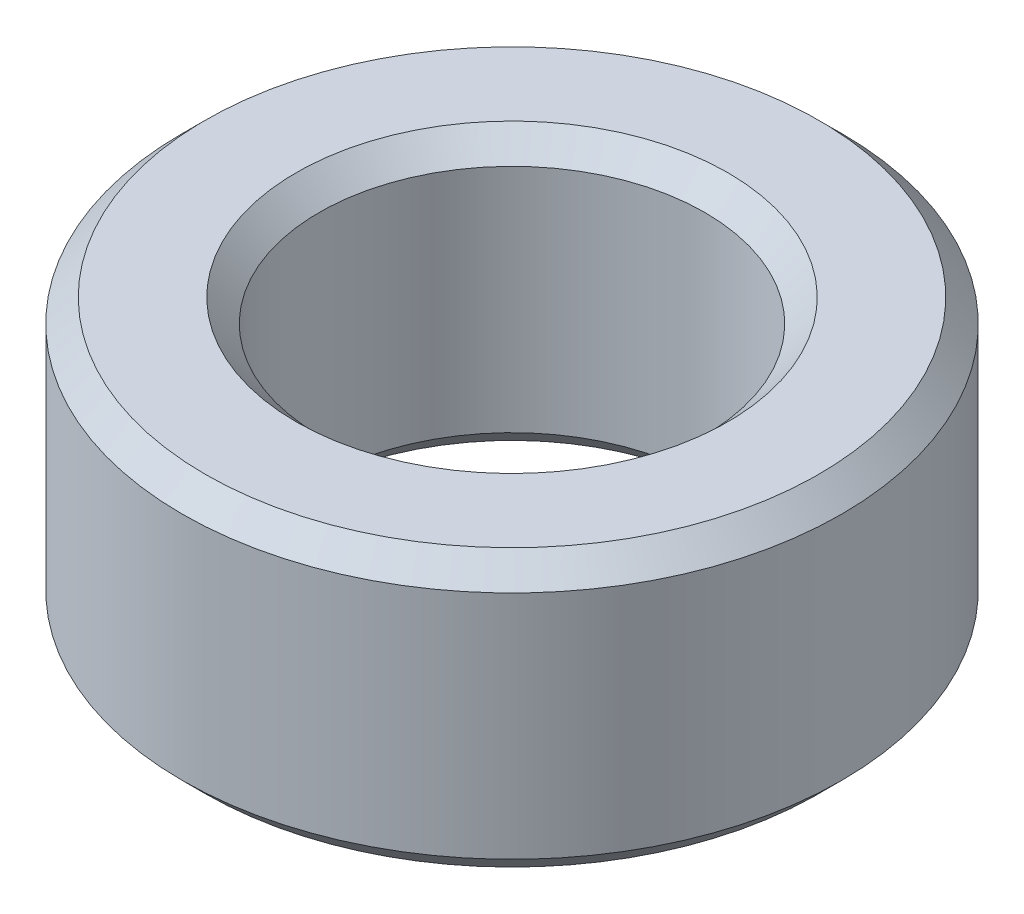
from build123d import *

# Parameters (mm, degrees)
SKETCH1_R           = 15
BOSS_EXTRUDE1_DEPTH = 12.584081472
SKETCH2_R           = 8.774640267
CUT_EXTRUDE1_DEPTH  = 25.664936783
CHAMFER1_SIZE       = 1.045426172


with BuildPart() as part:
    # Sketch1 → Boss-Extrude1 (new body)
    with BuildSketch(Plane(origin=(0, 0, 0), x_dir=(1, 0, 0), z_dir=(0, 1, 0))):
        Circle(SKETCH1_R)
    extrude(amount=BOSS_EXTRUDE1_DEPTH)

    # Sketch2 → Cut-Extrude1 (cut, through all)
    with BuildSketch(Plane(origin=(0, 0, 0), x_dir=(1, 0, 0), z_dir=(0, 1, 0))):
        Circle(SKETCH2_R)
    extrude(amount=CUT_EXTRUDE1_DEPTH, mode=Mode.SUBTRACT)

    # Chamfer1
    chamfer1_edges = [part.edges().sort_by_distance(p)[0] for p in [
        (-8.774640267, 12.584081472, 0),
        (-8.774640267, 0, 0),
        (-15, 0, 0),
        (-15, 12.584081472, 0),
    ]]
    chamfer(chamfer1_edges, length=CHAMFER1_SIZE)


solid = part.part
